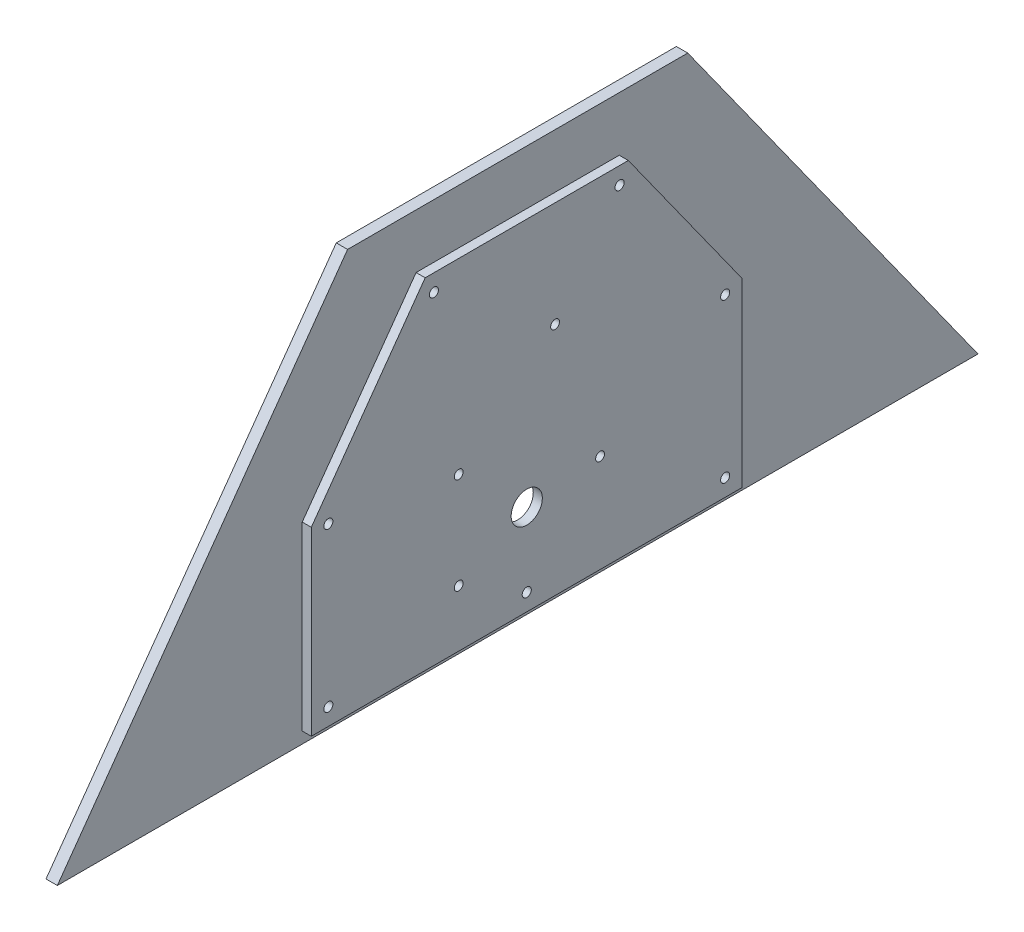
from build123d import *

# Parameters (mm, degrees)
ANGLEDBALLAST_DECKFRONT_OUTLINE_R = 2.5527
ANGLEDBALLAST_DECKFRONT_DEPTH     = 6.35
SKETCH1_R                         = 2.5527
BOSS_EXTRUDE1_DEPTH               = 5.08
SKETCH2_R                         = 8.73125
CUT_EXTRUDE1_DEPTH                = 344.853526084
F_10_CLEARANCE_HOLE1_AT_2_COUNT   = 2
F_10_CLEARANCE_HOLE1_AT_2_PITCH   = 53.975
F_10_CLEARANCE_HOLE1_AT_3_COUNT   = 2
F_10_CLEARANCE_HOLE1_AT_3_PITCH   = 113.433816282
F_10_CLEARANCE_HOLE1_AT_4_COUNT   = 2
F_10_CLEARANCE_HOLE1_AT_4_PITCH   = 82.478211039


# Read off the part's stored shape, not the designer's step: AngledBallast_DeckFront
with BuildPart() as part:
    # AngledBallast_DeckFront outline → AngledBallast_DeckFront (new body)
    with BuildSketch(Plane.YZ):
        Polygon((227.241295543, 95.25), (0, 257.81), (0, -257.81), (227.241295543, -95.25), align=None)
        with Locations((15.875, -111.125)):
            Circle(ANGLEDBALLAST_DECKFRONT_OUTLINE_R, mode=Mode.SUBTRACT)
        with Locations((104.656174089, -111.125)):
            Circle(ANGLEDBALLAST_DECKFRONT_OUTLINE_R, mode=Mode.SUBTRACT)
        with Locations((187.325, -51.986786112)):
            Circle(ANGLEDBALLAST_DECKFRONT_OUTLINE_R, mode=Mode.SUBTRACT)
        with Locations((15.875, 0)):
            Circle(ANGLEDBALLAST_DECKFRONT_OUTLINE_R, mode=Mode.SUBTRACT)
        with Locations((15.875, 111.125)):
            Circle(ANGLEDBALLAST_DECKFRONT_OUTLINE_R, mode=Mode.SUBTRACT)
        Polygon((101.6, -101.6), (25.4, -101.6), (25.4, 101.6), (101.6, 101.6), (177.8, 47.089344398), (177.8, -47.089344398), align=None, mode=Mode.SUBTRACT)
        with Locations((104.656174089, 111.125)):
            Circle(ANGLEDBALLAST_DECKFRONT_OUTLINE_R, mode=Mode.SUBTRACT)
        with Locations((187.325, 51.986786112)):
            Circle(ANGLEDBALLAST_DECKFRONT_OUTLINE_R, mode=Mode.SUBTRACT)
    extrude(amount=ANGLEDBALLAST_DECKFRONT_DEPTH)


with BuildPart() as body_2:
    # Sketch1 → Boss-Extrude1 (new body)
    with BuildSketch(Plane(origin=(6.35, 0, 0), x_dir=(0, 0, -1), z_dir=(1, 0, 0))):
        Polygon((120.65, 107.712348179), (56.884227826, 196.85), (-56.884227826, 196.85), (-120.65, 107.712348179), (-120.65, 6.35), (120.65, 6.35), align=None)
        with Locations((51.986786112, 187.325)):
            Circle(SKETCH1_R, mode=Mode.SUBTRACT)
        with Locations((111.125, 104.656174089)):
            Circle(SKETCH1_R, mode=Mode.SUBTRACT)
        with Locations((0, 15.875)):
            Circle(SKETCH1_R, mode=Mode.SUBTRACT)
        with Locations((111.125, 15.875)):
            Circle(SKETCH1_R, mode=Mode.SUBTRACT)
        with Locations((-111.125, 15.875)):
            Circle(SKETCH1_R, mode=Mode.SUBTRACT)
        with Locations((-111.125, 104.656174089)):
            Circle(SKETCH1_R, mode=Mode.SUBTRACT)
        with Locations((-51.986786112, 187.325)):
            Circle(SKETCH1_R, mode=Mode.SUBTRACT)
    extrude(amount=BOSS_EXTRUDE1_DEPTH)

    # Sketch2 → Cut-Extrude1 (cut, through all)
    with BuildSketch(Plane(origin=(11.43, 0, 0), x_dir=(0, 0, -1), z_dir=(1, 0, 0))):
        with Locations((0, 57.15)):
            Circle(SKETCH2_R)
    extrude(amount=-CUT_EXTRUDE1_DEPTH, mode=Mode.SUBTRACT)

    # Sketch5 → #10 Clearance Hole1 (revolve, cut)
    with BuildSketch(Plane(origin=(11.43, 38.1, 38.1), x_dir=(0, 0, -1), z_dir=(0, 1, 0))):
        Polygon((0, 0), (0, 13.433662253), (2.4892, 11.938), (2.4892, 0), align=None)
    f_10_clearance_hole1 = revolve(axis=Axis((17.78, 38.1, 38.1), (-1, 0, 0)), mode=Mode.SUBTRACT)

    # #10 Clearance Hole1 at 2: #10 Clearance Hole1 ×2
    with Locations(*[(0, i * F_10_CLEARANCE_HOLE1_AT_2_PITCH, 0) for i in range(1, F_10_CLEARANCE_HOLE1_AT_2_COUNT)]):
        add(f_10_clearance_hole1, mode=Mode.SUBTRACT)

    # #10 Clearance Hole1 at 3: #10 Clearance Hole1 ×2
    with Locations(*[Vector(0, 0.8795382859241794, -0.4758281240044103) * (i * F_10_CLEARANCE_HOLE1_AT_3_PITCH) for i in range(1, F_10_CLEARANCE_HOLE1_AT_3_COUNT)]):
        add(f_10_clearance_hole1, mode=Mode.SUBTRACT)

    # #10 Clearance Hole1 at 4: #10 Clearance Hole1 ×2
    with Locations(*[Vector(0, 0.28016697011361824, -0.9599512846271706) * (i * F_10_CLEARANCE_HOLE1_AT_4_PITCH) for i in range(1, F_10_CLEARANCE_HOLE1_AT_4_COUNT)]):
        add(f_10_clearance_hole1, mode=Mode.SUBTRACT)


solid = Compound([part.part, body_2.part])
